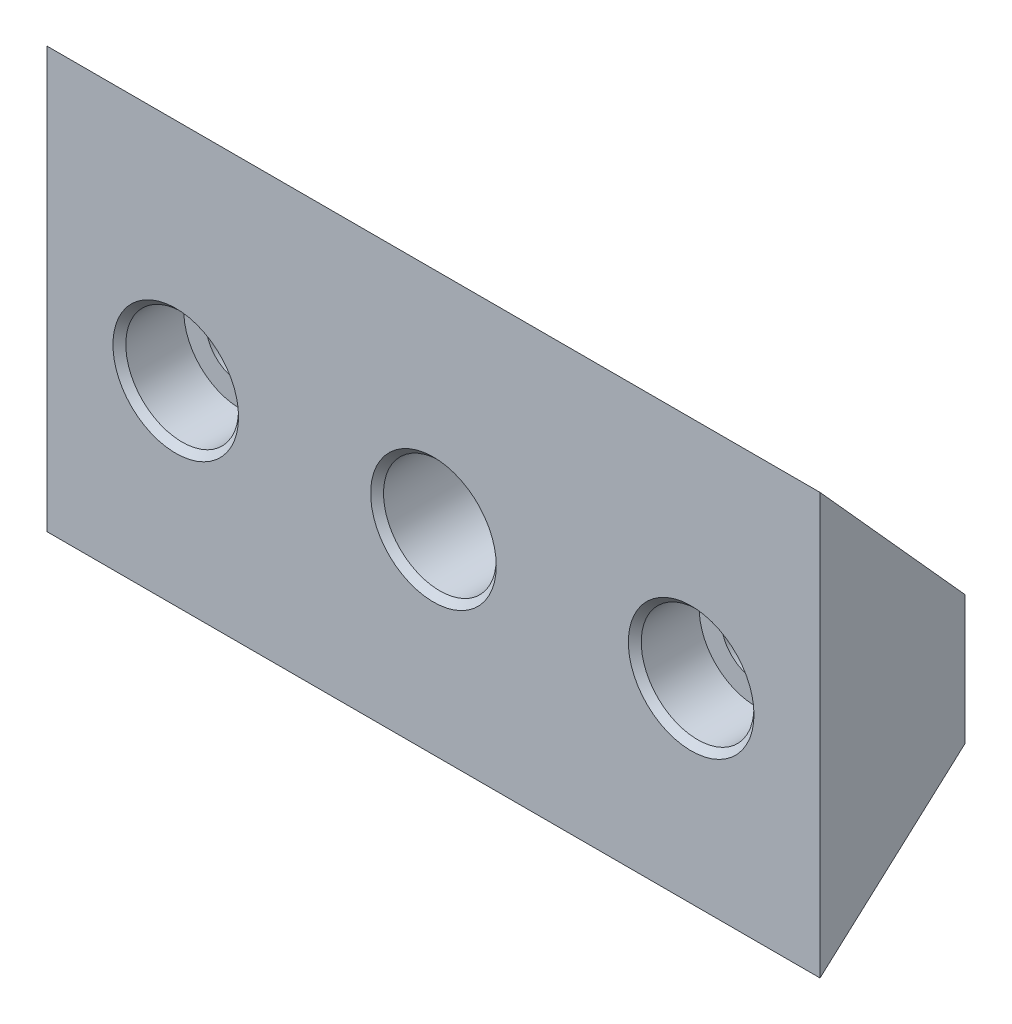
from build123d import *

# Parameters (mm, degrees)
SKETCH1_W                                     = 76.2
SKETCH1_H                                     = 44.45
BOSS_EXTRUDE1_DEPTH                           = 7.1501
CUT_EXTRUDE1_DEPTH                            = 80.696389849
CBORE_FOR_1_4_SOCKET_HEAD_CAP_SCREW1_AT_COUNT = 2
CBORE_FOR_1_4_SOCKET_HEAD_CAP_SCREW1_AT_PITCH = 50.8
CAVITY1_START                                 = -11.732042998
CAVITY1_OUTLINE_W                             = 78.1
CAVITY1_OUTLINE_H                             = 25
CAVITY1_DEPTH                                 = 2.228722608


# Read off the part's stored shape, not the designer's step: Cavity1
with BuildPart() as part:
    # Sketch1 → Boss-Extrude1 (new, symmetric)
    with BuildSketch(Plane.XY):
        Rectangle(SKETCH1_W, SKETCH1_H)
    extrude(amount=BOSS_EXTRUDE1_DEPTH, both=True)

    # Sketch2 → Cut-Extrude1 (cut, through all)
    with BuildSketch(Plane(origin=(38.1, 0, 0), x_dir=(0, 0, -1), z_dir=(1, 0, 0))):
        Polygon((7.1501, -6.343018915), (-7.1501, -22.225), (7.1501, -22.225), align=None)
        Polygon((-7.1501, 22.225), (7.1501, 6.343018915), (7.1501, 22.225), align=None)
    extrude(amount=-CUT_EXTRUDE1_DEPTH, mode=Mode.SUBTRACT)

    # Sketch6 → CBORE for 1/4 Socket Head Cap Screw1 (revolve, cut)
    with BuildSketch(Plane(origin=(-25.4, 0, 7.1501), x_dir=(0, -1, 0), z_dir=(1, 0, 0))):
        Polygon((0, 0), (0, 14.3002), (4.0132, 14.3002), (3.3782, 13.6652), (3.3782, 6.35), (5.55625, 6.35), (5.55625, 0.635), (6.19125, 0), align=None)
    cbore_for_1_4_socket_head_cap_screw1 = revolve(axis=Axis((-25.4, 0, 13.5001), (0, 0, -1)), mode=Mode.SUBTRACT)

    # CBORE for 1/4 Socket Head Cap Screw1 at: CBORE for 1/4 Socket Head Cap Screw1 ×2
    with Locations(*[(i * CBORE_FOR_1_4_SOCKET_HEAD_CAP_SCREW1_AT_PITCH, 0, 0) for i in range(1, CBORE_FOR_1_4_SOCKET_HEAD_CAP_SCREW1_AT_COUNT)]):
        add(cbore_for_1_4_socket_head_cap_screw1, mode=Mode.SUBTRACT)

    # Sketch8 → 7/16 (0.4375) Diameter Hole1 (revolve, cut)
    with BuildSketch(Plane(origin=(0, 0, 7.1501), x_dir=(0, -1, 0), z_dir=(1, 0, 0))):
        Polygon((0, 0), (0, 14.3002), (6.19125, 14.3002), (5.55625, 13.6652), (5.55625, 0.635), (6.19125, 0), align=None)
    revolve(axis=Axis((0, 0, 13.5001), (0, 0, -1)), mode=Mode.SUBTRACT)

    # Cavity1 outline → Cavity1 (cut)
    with BuildSketch(Plane(origin=(0, 0, 0), x_dir=(1, 0, 0), z_dir=(0, 0.7431448254773938, 0.6691306063588588)).offset(CAVITY1_START)):
        with Locations((-0.95, -9.5)):
            Rectangle(CAVITY1_OUTLINE_W, CAVITY1_OUTLINE_H)
    extrude(amount=CAVITY1_DEPTH, mode=Mode.SUBTRACT)


solid = part.part
